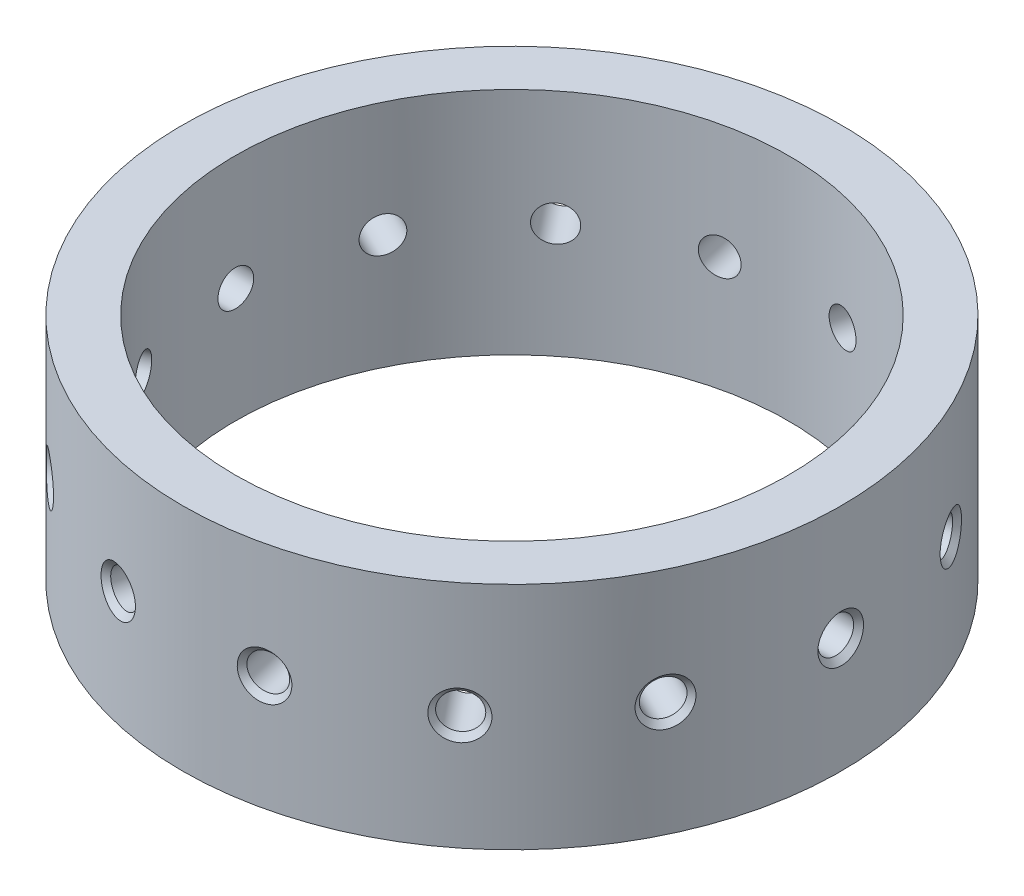
from build123d import *

# Parameters (mm, degrees)
CIRPATTERN1_COUNT = 14
SKETCH3_W         = 21.29
SKETCH3_H         = 4


# Read off the part's stored shape, not the designer's step: M5 Tapped Hole1
with BuildPart() as part:
    # Sketch1 → Revolve1 (revolve)
    with BuildSketch(Plane.XY, mode=Mode.PRIVATE) as revolve1_sk:
        Polygon((32.5, 0), (60, 0), (60, 3), (57, 3), (57, 4), (38.71, 4), (38.71, 27), (32.5, 27), align=None)
    revolve(revolve1_sk.sketch.rotate(Axis((0, 0, 0), (0, -1, 0)), 90), axis=Axis((0, 0, 0), (0, -1, 0)))

    # M5 Tapped Hole1 outline → M5 Tapped Hole1 (revolve, cut)
    with BuildSketch(Plane(origin=(0, 13.5, 0), x_dir=(0, 1, 0), z_dir=(0, 0, -1))):
        Polygon((2.775016183, 38.710016183), (0, 38.710016183), (0, 32.432046302), (2.1, 32.432046302), (2.1, 38.035), align=None)
    m5_tapped_hole1 = revolve(axis=Axis((0, 13.5, 0), (1, 0, 0)), mode=Mode.SUBTRACT)

    # CirPattern1: M5 Tapped Hole1 ×14 about axis
    cirpattern1_axis = Axis((0, 0, 0), (0, 1, 0))
    for i in range(1, CIRPATTERN1_COUNT):
        add(m5_tapped_hole1.rotate(cirpattern1_axis, i * 360 / CIRPATTERN1_COUNT), mode=Mode.SUBTRACT)

    # Sketch3 → Cut-Revolve1 (revolve, cut)
    with BuildSketch(Plane.XY, mode=Mode.PRIVATE) as cut_revolve1_sk:
        with Locations((49.355, 2)):
            Rectangle(SKETCH3_W, SKETCH3_H)
    revolve(cut_revolve1_sk.sketch.rotate(Axis((0, 0, 0), (0, -1, 0)), 90), axis=Axis((0, 0, 0), (0, -1, 0)), mode=Mode.SUBTRACT)


solid = part.part
